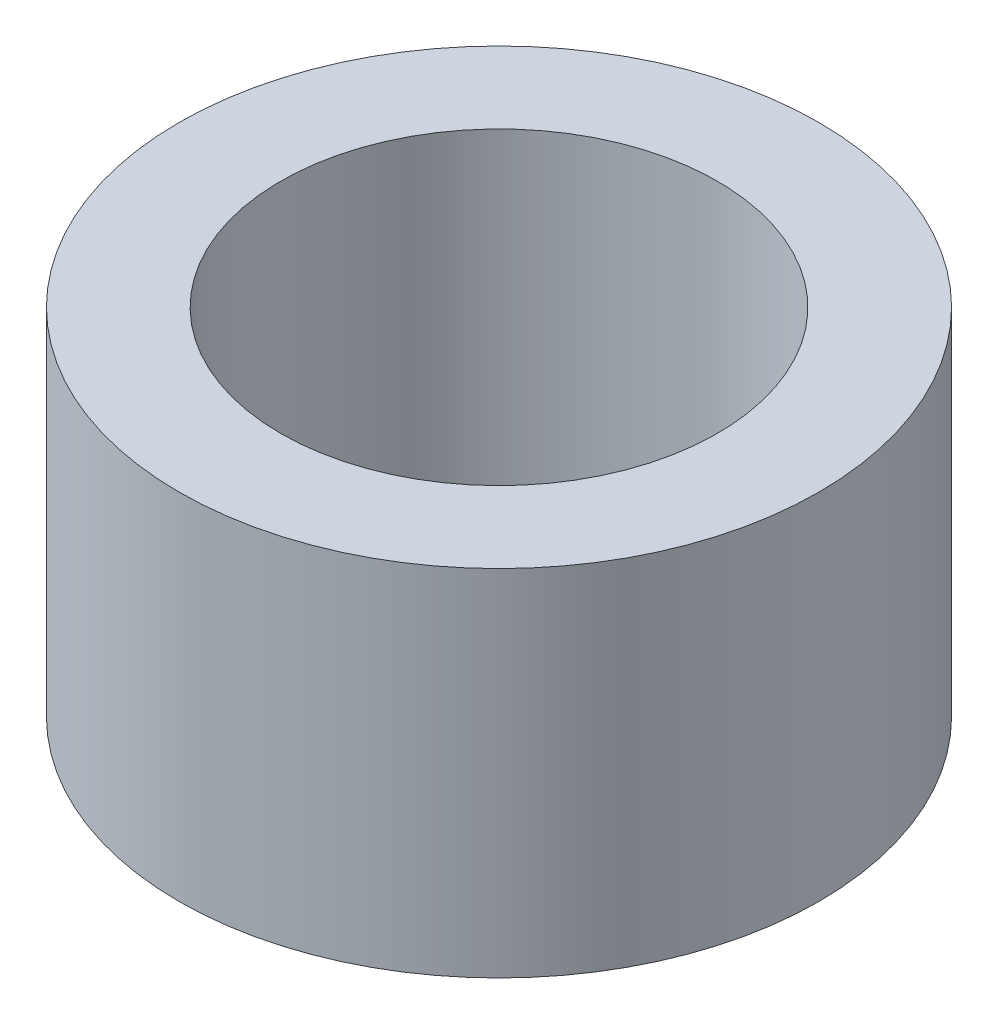
from build123d import *
from OCP.BRepAlgoAPI import BRepAlgoAPI_Cut
from OCP.TopTools import TopTools_ListOfShape

# Parameters (mm, degrees)
SKETCH1_R           = 8.001
SKETCH1_R_2         = 5.461
BOSS_EXTRUDE1_DEPTH = 8.864442387
CUT_EXTRUDE1_START  = 8.864442
SKETCH1_6_R         = 5.461
CUT_EXTRUDE1_DEPTH  = 9.46


with BuildPart() as part:
    # Sketch1 → Boss-Extrude1 (new body)
    # profile 1 of 2: a face of its own
    with BuildSketch(Plane(origin=(0, 0, 0), x_dir=(1, 0, 0), z_dir=(0, 1, 0))):
        with Locations(Location((0, 0, 0), (0, 0, 270))):
            Circle(SKETCH1_R)
        Circle(SKETCH1_R_2, mode=Mode.SUBTRACT)
    # profile 2 of 2: a face of its own
    with BuildSketch(Plane(origin=(0, 0, 0), x_dir=(1, 0, 0), z_dir=(0, 1, 0))):
        Circle(SKETCH1_R_2)
    extrude(amount=BOSS_EXTRUDE1_DEPTH)

    # Sketch2 → Revolve1 (revolve)
    with BuildSketch(Plane.XY, mode=Mode.PRIVATE) as revolve1_sk:
        Polygon((0, 0), (0, -3.135557613), (8.001, 0), align=None)
    revolve(revolve1_sk.sketch.rotate(Axis((0, 0, 0), (0, -1, 0)), 180), axis=Axis((0, 0, 0), (0, -1, 0)))


with BuildPart() as cut_extrude1_tool:
    # Sketch1<6> → Cut-Extrude1 (new body)
    with BuildSketch(Plane(origin=(0, 0, 0), x_dir=(1, 0, 0), z_dir=(0, 1, 0)).offset(CUT_EXTRUDE1_START)):
        with Locations(Location((0, 0, 0), (0, 0, 270))):
            Circle(SKETCH1_6_R)
    extrude(amount=-CUT_EXTRUDE1_DEPTH)


with BuildPart() as part_1:
    add(part.part)

    # Cut-Extrude1: cut by cut_extrude1_tool, with a tolerance
    cut_extrude1_stock = TopTools_ListOfShape()
    cut_extrude1_stock.Append(part_1.part.wrapped)
    cut_extrude1_tools = TopTools_ListOfShape()
    cut_extrude1_tools.Append(cut_extrude1_tool.part.wrapped)
    cut_extrude1_cut = BRepAlgoAPI_Cut()
    cut_extrude1_cut.SetArguments(cut_extrude1_stock)
    cut_extrude1_cut.SetTools(cut_extrude1_tools)
    cut_extrude1_cut.SetFuzzyValue(0.00001)
    cut_extrude1_cut.Build()
    add(Compound.cast(cut_extrude1_cut.Shape()).solids(), mode=Mode.REPLACE)


solid = part_1.part
